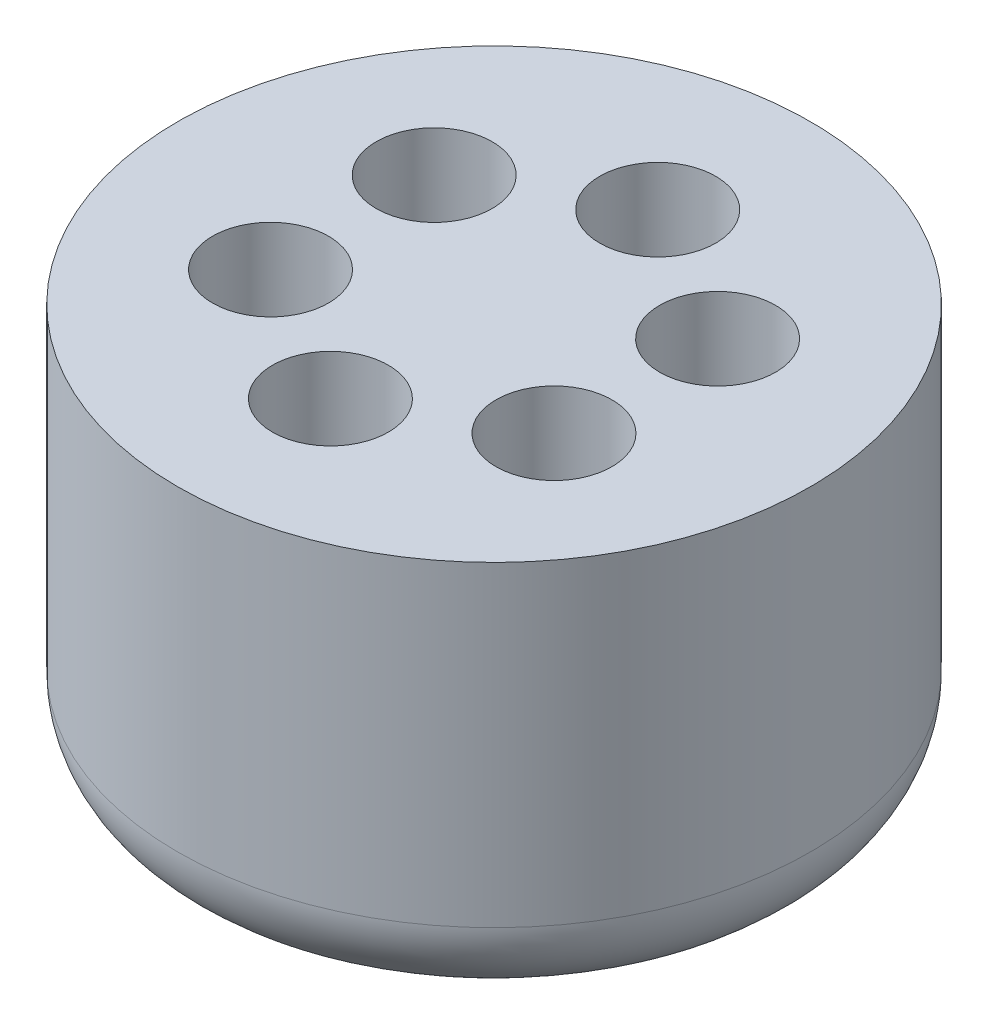
from build123d import *

# Parameters (mm, degrees)
SKETCH1_R           = 30
BOSS_EXTRUDE1_DEPTH = 38
SKETCH2_R           = 5.5
CUT_EXTRUDE1_DEPTH  = 32
FILLET1_R           = 8
SKETCH2_3_R         = 5.5
CUT_EXTRUDE2_DEPTH  = 35


with BuildPart() as part:
    # Sketch1 → Boss-Extrude1 (new body)
    with BuildSketch(Plane(origin=(0, 0, 0), x_dir=(1, 0, 0), z_dir=(0, 1, 0))):
        Circle(SKETCH1_R)
    extrude(amount=BOSS_EXTRUDE1_DEPTH)

    # Sketch2 → Cut-Extrude1 (cut)
    with BuildSketch(Plane(origin=(0, 38, 0), x_dir=(1, 0, 0), z_dir=(0, 1, 0))):
        with Locations((0, 15.52)):
            Circle(SKETCH2_R)
        with Locations((-13.440714267, 7.76)):
            Circle(SKETCH2_R)
        with Locations((-13.440714267, -7.76)):
            Circle(SKETCH2_R)
        with Locations((0, -15.52)):
            Circle(SKETCH2_R)
        with Locations((13.440714267, -7.76)):
            Circle(SKETCH2_R)
        with Locations((13.440714267, 7.76)):
            Circle(SKETCH2_R)
    extrude(amount=-CUT_EXTRUDE1_DEPTH, mode=Mode.SUBTRACT)

    # Fillet1
    fillet1_edges = [part.edges().sort_by_distance(p)[0] for p in [
        (-30, 0, 0),
    ]]
    fillet(fillet1_edges, radius=FILLET1_R)

    # Sketch2<3> → Cut-Extrude2 (cut)
    with BuildSketch(Plane(origin=(0, 38, 0), x_dir=(1, 0, 0), z_dir=(0, 1, 0))):
        with Locations((0, 15.52)):
            Circle(SKETCH2_3_R)
        with Locations((-13.440714267, 7.76)):
            Circle(SKETCH2_3_R)
        with Locations((-13.440714267, -7.76)):
            Circle(SKETCH2_3_R)
        with Locations((0, -15.52)):
            Circle(SKETCH2_3_R)
        with Locations((13.440714267, -7.76)):
            Circle(SKETCH2_3_R)
        with Locations((13.440714267, 7.76)):
            Circle(SKETCH2_3_R)
    extrude(amount=-CUT_EXTRUDE2_DEPTH, mode=Mode.SUBTRACT)


solid = part.part
